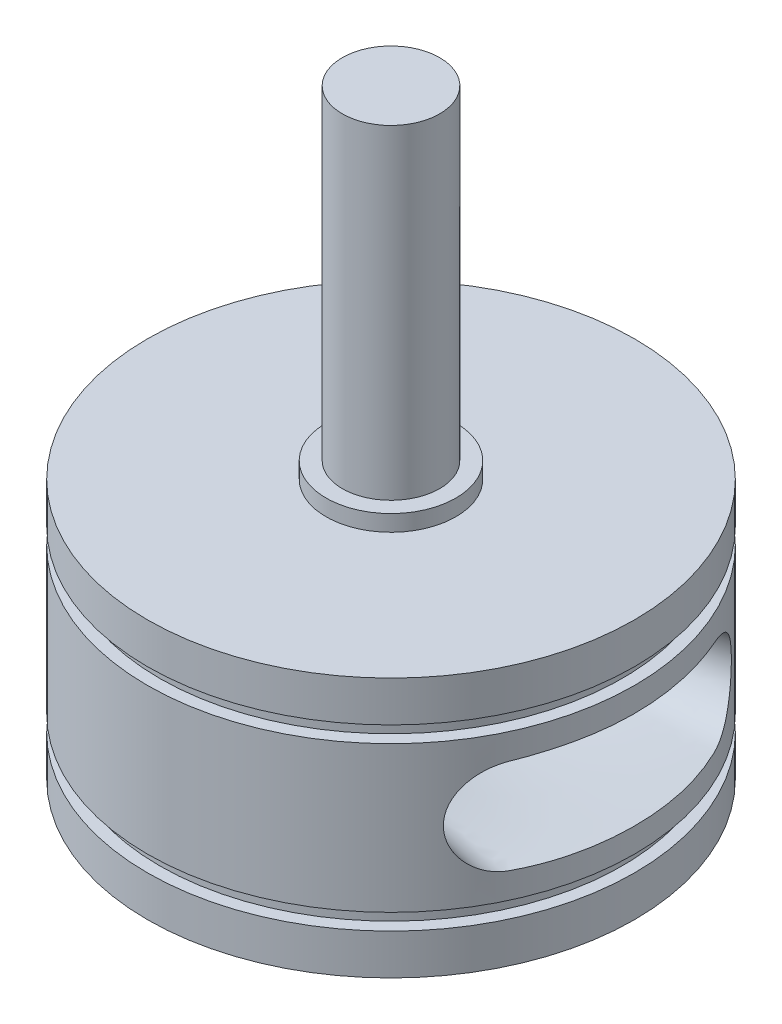
from build123d import *


with BuildPart() as part:
    # Esboço1 → Revolução1 (revolve)
    with BuildSketch(Plane.XY, mode=Mode.PRIVATE) as revolu_o1_sk:
        Polygon((0, 29), (3, 29), (3, 9), (4, 9), (4, 8), (15, 8), (15, 5.5), (14.25, 5.5), (14.25, 4.5), (15, 4.5), (15, -4.5), (14.25, -4.5), (14.25, -5.5), (15, -5.5), (15, -8), (4, -8), (4, -9), (3, -9), (3, -12), (0, -12), (0, 0), align=None)
    revolve(revolu_o1_sk.sketch.rotate(Axis((0, 0, 0), (0, 1, 0)), 90), axis=Axis((0, 0, 0), (0, 1, 0)))

    # Loft de corte1: read off the stored shape, not the designer's step
    # Loft de corte1: loft between two sections, ruled curve by curve
    loft_de_corte1_from = [
        Edge.make_bspline([(15, 3, -6.499999998), (15, 3, -6.824955331), (15, 2.894080758, -7.511612667), (15, 2.323207443, -8.52324288), (15, 1.314094875, -9.301280201), (15, 0, -9.600009215), (15, -1.314094875, -9.301280201), (15, -2.323207443, -8.52324288), (15, -2.894080758, -7.511612667), (15, -3, -6.824955331), (15, -3, -5.890589586), (15, -3, -4.730897439), (15, -3, -3.107757012), (15, -3, -1.540026122), (15, -3, 0), (15, -3, 1.540026122), (15, -3, 3.107757012), (15, -3, 4.730897439), (15, -3, 5.890589586), (15, -3, 6.824955331), (15, -2.894080758, 7.511612667), (15, -2.323207443, 8.52324288), (15, -1.314094875, 9.301280201), (15, 0, 9.600009215), (15, 1.314094875, 9.301280201), (15, 2.323207443, 8.52324288), (15, 2.894080758, 7.511612667), (15, 3, 6.824955331), (15, 3, 5.890589586), (15, 3, 4.730897439), (15, 3, 3.107757012), (15, 3, 1.540026122), (15, 3, 0), (15, 3, -1.540026122), (15, 3, -3.107757012), (15, 3, -4.730897439), (15, 3, -5.890589586), (15, 3, -6.499999998)], [0, 0, 0, 0, 0.021736358, 0.043472716, 0.065209074, 0.086945432, 0.10868179, 0.130418148, 0.152154506, 0.173890864, 0.173890864, 0.214654506, 0.255418148, 0.29618179, 0.336945432, 0.377709074, 0.418472716, 0.459236358, 0.5, 0.5, 0.521736358, 0.543472716, 0.565209074, 0.586945432, 0.60868179, 0.630418148, 0.652154506, 0.673890864, 0.673890864, 0.714654506, 0.755418148, 0.79618179, 0.836945432, 0.877709074, 0.918472716, 0.959236358, 1, 1, 1, 1], 3),
    ]
    loft_de_corte1_to = [
        Edge.make_bspline([(-15, 1.257174528, -2.723878155), (-15, 1.133171283, -2.781110422), (-15, 0.904058011, -2.868761786), (-15, 0.593969465, -2.944793646), (-15, 0.29436397, -2.990374654), (-15, 0, -3.005552445), (-15, -0.29436397, -2.990374654), (-15, -0.593969465, -2.944793646), (-15, -0.904058011, -2.868761786), (-15, -1.133171283, -2.781110422), (-15, -1.489726085, -2.616546668), (-15, -1.943458979, -2.334486452), (-15, -2.518379121, -1.706139583), (-15, -2.907784722, -0.903903988), (-15, -3.046232987, 0), (-15, -2.907784722, 0.903903988), (-15, -2.518379121, 1.706139583), (-15, -1.943458979, 2.334486452), (-15, -1.489726085, 2.616546668), (-15, -1.133171283, 2.781110422), (-15, -0.904058011, 2.868761786), (-15, -0.593969465, 2.944793646), (-15, -0.29436397, 2.990374654), (-15, 0, 3.005552445), (-15, 0.29436397, 2.990374654), (-15, 0.593969465, 2.944793646), (-15, 0.904058011, 2.868761786), (-15, 1.133171283, 2.781110422), (-15, 1.489726085, 2.616546668), (-15, 1.943458979, 2.334486452), (-15, 2.518379121, 1.706139583), (-15, 2.907784722, 0.903903988), (-15, 3.046232987, 0), (-15, 2.907784722, -0.903903988), (-15, 2.518379121, -1.706139583), (-15, 1.943458979, -2.334486452), (-15, 1.489726085, -2.616546668), (-15, 1.257174528, -2.723878155)], [0, 0, 0, 0, 0.021736358, 0.043472716, 0.065209074, 0.086945432, 0.10868179, 0.130418148, 0.152154506, 0.173890864, 0.173890864, 0.214654506, 0.255418148, 0.29618179, 0.336945432, 0.377709074, 0.418472716, 0.459236358, 0.5, 0.5, 0.521736358, 0.543472716, 0.565209074, 0.586945432, 0.60868179, 0.630418148, 0.652154506, 0.673890864, 0.673890864, 0.714654506, 0.755418148, 0.79618179, 0.836945432, 0.877709074, 0.918472716, 0.959236358, 1, 1, 1, 1], 3),
    ]
    loft_de_corte1 = Solid(Shell([*[Face.make_surface_from_curves(loft_de_corte1_from[k], loft_de_corte1_to[k]) for k in range(1)], Face(Wire(loft_de_corte1_from)), Face(Wire(loft_de_corte1_to))]))
    add(loft_de_corte1, mode=Mode.SUBTRACT)


solid = part.part
